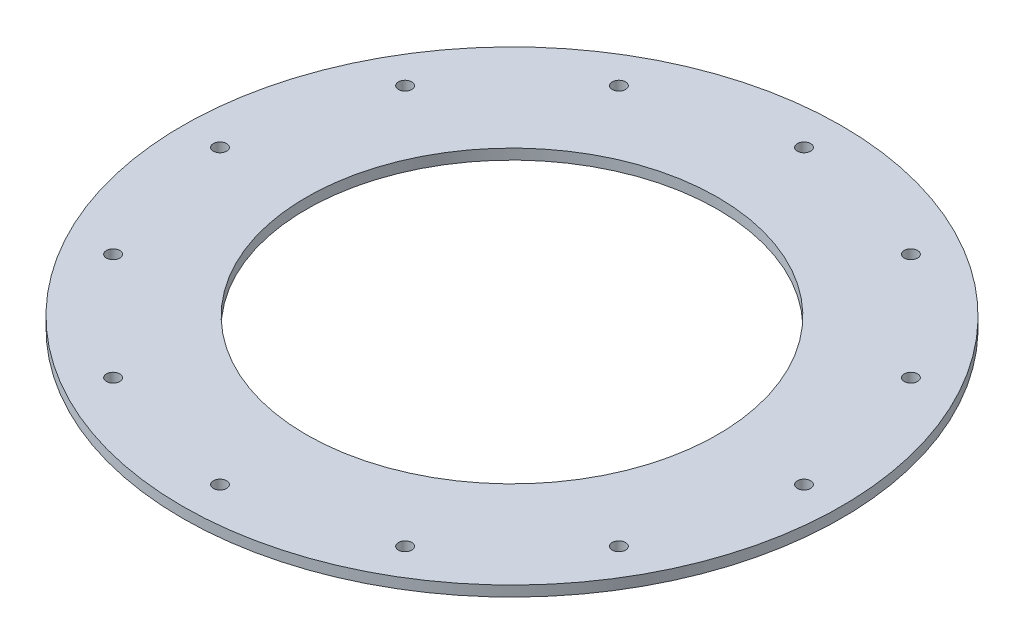
from build123d import *

# Parameters (mm, degrees)
SKETCH1_R           = 79
SKETCH1_R_2         = 49.3
BOSS_EXTRUDE1_DEPTH = 2.5
SKETCH2_R           = 1.6
CUT_EXTRUDE1_DEPTH  = 112.750838923


with BuildPart() as part:
    # Sketch1 → Boss-Extrude1 (new body)
    with BuildSketch(Plane(origin=(0, 0, 0), x_dir=(1, 0, 0), z_dir=(0, 1, 0))):
        Circle(SKETCH1_R)
        Circle(SKETCH1_R_2, mode=Mode.SUBTRACT)
    extrude(amount=BOSS_EXTRUDE1_DEPTH)

    # Sketch2 → Cut-Extrude1 (cut, through all)
    with BuildSketch(Plane(origin=(0, 2.5, 0), x_dir=(1, 0, 0), z_dir=(0, 1, 0))):
        with Locations((0, 70)):
            Circle(SKETCH2_R)
        with Locations((35, 60.621778265)):
            Circle(SKETCH2_R)
        with Locations((60.621778265, 35)):
            Circle(SKETCH2_R)
        with Locations((70, 0)):
            Circle(SKETCH2_R)
        with Locations((60.621778265, -35)):
            Circle(SKETCH2_R)
        with Locations((35, -60.621778265)):
            Circle(SKETCH2_R)
        with Locations((0, -70)):
            Circle(SKETCH2_R)
        with Locations((-35, -60.621778265)):
            Circle(SKETCH2_R)
        with Locations((-60.621778265, -35)):
            Circle(SKETCH2_R)
        with Locations((-70, 0)):
            Circle(SKETCH2_R)
        with Locations((-60.621778265, 35)):
            Circle(SKETCH2_R)
        with Locations((-35, 60.621778265)):
            Circle(SKETCH2_R)
    extrude(amount=-CUT_EXTRUDE1_DEPTH, mode=Mode.SUBTRACT)


solid = part.part
